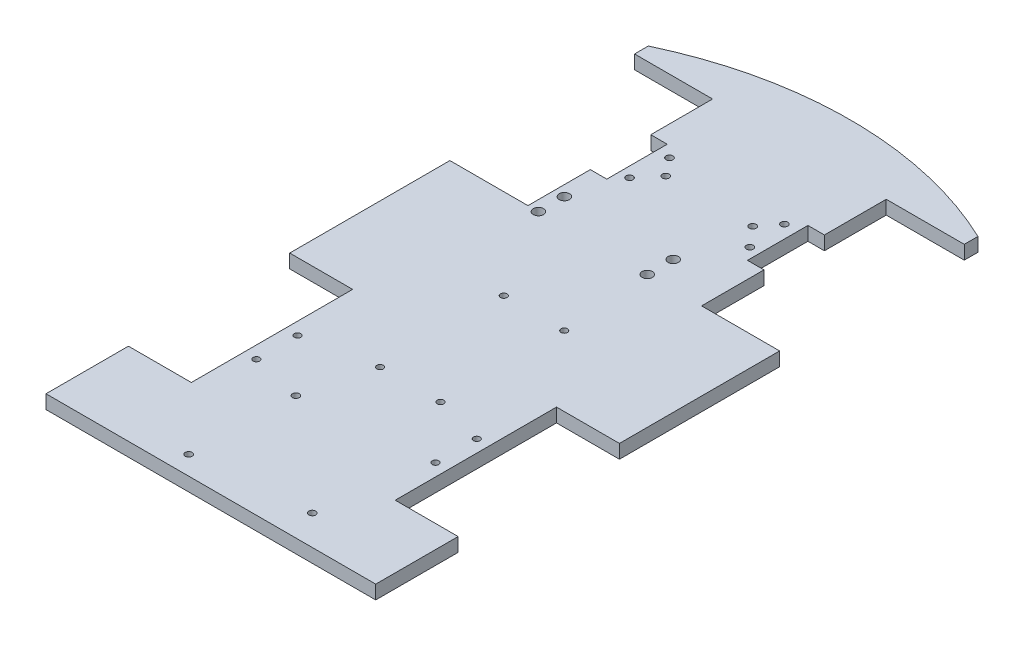
from build123d import *

# Parameters (mm, degrees)
CHASSIS_DEPTH      = 6.35
SKETCH2_R          = 1.5875
SKETCH2_R_2        = 2.38125
SKETCH2_R_3        = 1.5
CUT_EXTRUDE1_DEPTH = 17.78


with BuildPart() as part:
    # Sketch1 → Chassis (new body)
    with BuildSketch(Plane(origin=(0, 0, 0), x_dir=(1, 0, 0), z_dir=(0, 1, 0))):
        with BuildLine():
            ThreePointArc((76.2, 49.022), (39.053241005, 61.832834411), (0, 66.173750115))
            Line((0, 66.173750115), (0, -229.362))
            Line((0, -229.362), (76.2, -229.362))
            Line((76.2, -229.362), (76.2, -191.262))
            Line((76.2, -191.262), (47.117, -191.262))
            Line((47.117, -191.262), (47.117, -116.713))
            Line((47.117, -116.713), (76.2, -116.713))
            Line((76.2, -116.713), (76.2, -42.672))
            Line((76.2, -42.672), (40.132, -42.672))
            Line((40.132, -42.672), (40.132, -13.843))
            Line((40.132, -13.843), (32.512, -13.843))
            Line((32.512, -13.843), (32.512, 14.097))
            Line((32.512, 14.097), (40.132, 14.097))
            Line((40.132, 14.097), (40.132, 42.672))
            Line((40.132, 42.672), (76.2, 42.672))
            Line((76.2, 42.672), (76.2, 49.022))
        make_face()
    chassis = extrude(amount=CHASSIS_DEPTH)

    # Mirror1: Chassis across plane
    add(chassis.mirror(Plane(origin=(0, 6.35, 0), x_dir=(0, 0, 1), z_dir=(1, 0, 0))))

    # Sketch2 → Cut-Extrude1 (cut)
    with BuildSketch(Plane(origin=(0, 0, 0), x_dir=(1, 0, 0), z_dir=(0, 1, 0))):
        with Locations((-17.703140953, -172.359887538)):
            Circle(SKETCH2_R)
        with Locations((-18.973140953, -220.619887538)):
            Circle(SKETCH2_R)
        with Locations((33.096859047, -215.539887538)):
            Circle(SKETCH2_R)
        with Locations((-26.555704526, 9.169971692)):
            Circle(SKETCH2_R)
        with Locations((-20.105647723, 0.999384842)):
            Circle(SKETCH2_R)
        with Locations((-27.786476371, -8.040568412)):
            Circle(SKETCH2_R)
        with Locations((26.555704526, 9.169971692)):
            Circle(SKETCH2_R)
        with Locations((20.105647723, 0.999384842)):
            Circle(SKETCH2_R)
        with Locations((27.786476371, -8.040568412)):
            Circle(SKETCH2_R)
        with Locations((15, -30.652833299)):
            Circle(SKETCH2_R_2)
        with Locations((15, -42.652833299)):
            Circle(SKETCH2_R_2)
        with Locations((-35.3, -30.652833299)):
            Circle(SKETCH2_R_2)
        with Locations((-35.3, -42.652833299)):
            Circle(SKETCH2_R_2)
        with Locations((18.288, -84.328)):
            Circle(SKETCH2_R_3)
        with Locations((-9.652, -84.328)):
            Circle(SKETCH2_R_3)
        with Locations((18.288, -141.478)):
            Circle(SKETCH2_R_3)
        with Locations((-9.652, -141.478)):
            Circle(SKETCH2_R_3)
        with Locations((-41.402, -147.875000023)):
            Circle(SKETCH2_R_3)
        with Locations((-41.402, -166.925000023)):
            Circle(SKETCH2_R_3)
        with Locations((41.402, -147.874999977)):
            Circle(SKETCH2_R_3)
        with Locations((41.402, -166.924999977)):
            Circle(SKETCH2_R_3)
    extrude(amount=CUT_EXTRUDE1_DEPTH, mode=Mode.SUBTRACT)


solid = part.part
